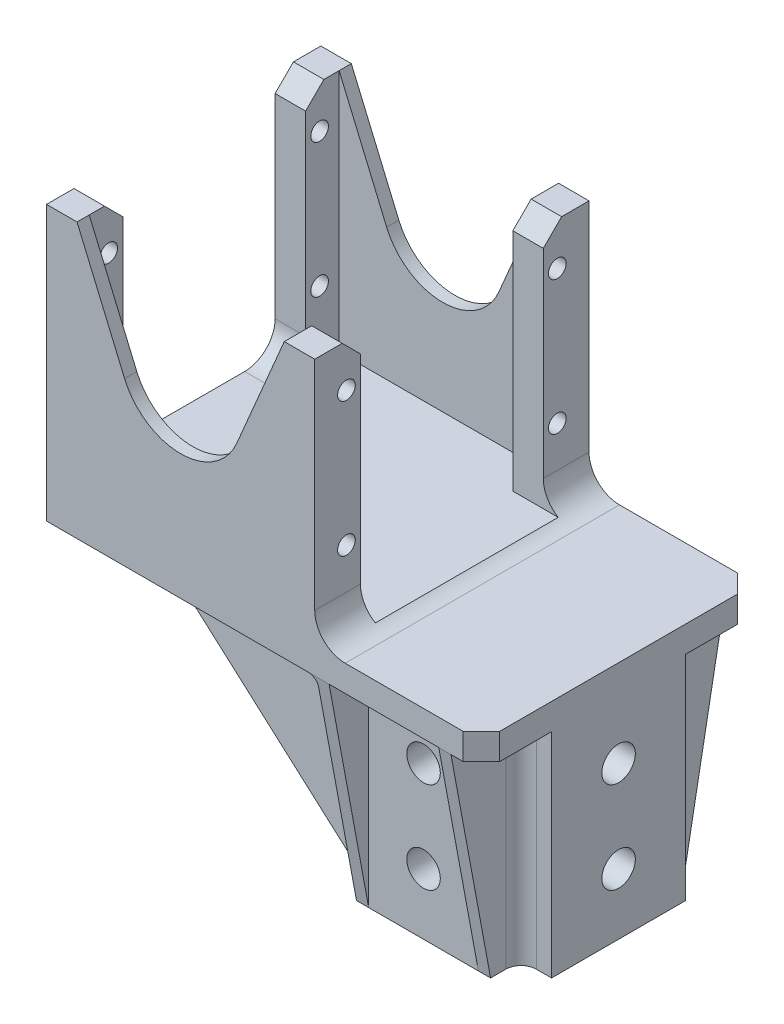
from build123d import *

# Parameters (mm, degrees)
BOSS_EXTRUDE1_DEPTH           = 45
SKETCH3_W                     = 30
SKETCH3_H                     = 40
CUT_EXTRUDE1_DEPTH            = 88.304481557
SKETCH4_W                     = 32
SKETCH4_H                     = 32
SKETCH4_W_2                   = 20.5
SKETCH4_H_2                   = 20.5
BOSS_EXTRUDE2_DEPTH           = 35
SKETCH6_W                     = 5
SKETCH6_H                     = 5
CUT_EXTRUDE4_DEPTH            = 35
RIB1_REACH                    = 87.394
SKETCH9_WALL_W                = 225.450736488
SKETCH9_WALL_H                = 2
LPATTERN1_COUNT               = 2
LPATTERN1_PITCH               = 20
RIB6_REACH                    = 100.659
SKETCH14_WALL_W               = 234.916193708
SKETCH14_WALL_H               = 2
RIB7_START                    = -2
RIB7_DEPTH                    = 2
FILLET2_R                     = 5
FILLET3_R                     = 5
RIB10_REACH                   = 92.525
SKETCH17_WALL_W               = 226.513312862
SKETCH17_WALL_H               = 2
RIB11_REACH                   = 92.525
SKETCH18_WALL_W               = 226.513312862
SKETCH18_WALL_H               = 2
FILLET4_R                     = 10
LPATTERN2_COUNT               = 2
LPATTERN2_PITCH               = 43
FILLET4_OF_LPATTERN2_R        = 10
M5_CLEARANCE_HOLE2_AT_2_COUNT = 2
M5_CLEARANCE_HOLE2_AT_2_PITCH = 15
M2_5_CLEARANCE_HOLE1_D        = 2.9
FILLET5_R                     = 2.5
SKETCH4_4_R                   = 2.5
BOSS_EXTRUDE4_DEPTH           = 8
CIRPATTERN1_COUNT             = 4
CHAMFER1_SIZE                 = 3
FILLET6_R                     = 5
FILLET7_R                     = 1.5
SKETCH27_W                    = 27.35
SKETCH27_H                    = 5.7
CUT_EXTRUDE6_DEPTH            = 91.525342619
FILLET8_R                     = 5


# Read off the part's stored shape, not the designer's step: Rib7
with BuildPart() as part:
    # Sketch2 → Boss-Extrude1 (new body)
    with BuildSketch(Plane.XY):
        Polygon((-53.5125, -22.5), (17.8375, -22.5), (17.8375, -17.5), (-9.5125, -17.5), (-9.5125, 22.5), (-14.5125, 22.5), (-14.5125, -17.5), (-48.5125, -17.5), (-48.5125, 22.5), (-53.5125, 22.5), align=None)
    extrude(amount=BOSS_EXTRUDE1_DEPTH)

    # Sketch3 → Cut-Extrude1 (cut, through all)
    with BuildSketch(Plane(origin=(-53.5125, 0, 0), x_dir=(0, 0, -1), z_dir=(1, 0, 0))):
        with Locations((-22.5, 2.5)):
            Rectangle(SKETCH3_W, SKETCH3_H)
    extrude(amount=CUT_EXTRUDE1_DEPTH, mode=Mode.SUBTRACT)

    # Sketch4 → Boss-Extrude2 (add)
    with BuildSketch(Plane.XZ.offset(22.5)):
        with Locations((1.8375, 22.5)):
            Rectangle(SKETCH4_W, SKETCH4_H)
        with Locations((1.8375, 22.5)):
            Rectangle(SKETCH4_W_2, SKETCH4_H_2, mode=Mode.SUBTRACT)
    extrude(amount=BOSS_EXTRUDE2_DEPTH)

    # Sketch6 → Cut-Extrude4 (cut)
    with BuildSketch(Plane(origin=(0, -57.5, 0), x_dir=(-1, 0, 0), z_dir=(0, -1, 0))):
        with Locations((11.6625, -36)):
            Rectangle(SKETCH6_W, SKETCH6_H)
        with Locations((-15.3375, -36)):
            Rectangle(SKETCH6_W, SKETCH6_H)
        with Locations((-15.3375, -9)):
            Rectangle(SKETCH6_W, SKETCH6_H)
        with Locations((11.6625, -9)):
            Rectangle(SKETCH6_W, SKETCH6_H)
    extrude(amount=-CUT_EXTRUDE4_DEPTH, mode=Mode.SUBTRACT)

    # Sketch9 wall → Rib1 (add, up to next)
    with BuildSketch(Plane(origin=(-33.8375, -40, 33.5), x_dir=(-0.747199752598, 0.664599525818, 0), z_dir=(-0.664599525818, -0.747199752598, 0)), mode=Mode.PRIVATE) as rib1_sk1:
        with Locations((0, 1)):
            Rectangle(SKETCH9_WALL_W, SKETCH9_WALL_H)
    rib1_tool1 = extrude(rib1_sk1.sketch, amount=-RIB1_REACH, mode=Mode.PRIVATE) - part.part
    rib1 = rib1_tool1.solids().sort_by_distance((-33.8375, -40, 33.5))[0]
    add(rib1)

    # LPattern1: Rib1 ×2
    with Locations(*[(0, 0, -i * LPATTERN1_PITCH) for i in range(1, LPATTERN1_COUNT)]):
        add(rib1)

    # Sketch14 wall → Rib6 (add, up to next)
    with BuildSketch(Plane(origin=(12.8375, -40, 3.25), x_dir=(0, 0.983188736076, -0.182592193843), z_dir=(0, 0.182592193843, 0.983188736076)), mode=Mode.PRIVATE) as rib6_sk1:
        with Locations((0, 1)):
            Rectangle(SKETCH14_WALL_W, SKETCH14_WALL_H)
    rib6_tool1 = extrude(rib6_sk1.sketch, amount=RIB6_REACH, mode=Mode.PRIVATE) - part.part
    rib6 = rib6_tool1.solids().sort_by_distance((12.8375, -40, 3.25))[0]
    add(rib6)

    # Rib7 outline → Rib7 (add)
    with BuildSketch(Plane.ZY.offset(9.1625).offset(RIB7_START)):
        Polygon((0, -22.5), (6.5, -57.5), (6.5, -22.5), align=None)
    rib7 = extrude(amount=RIB7_DEPTH)

    # Fillet2
    fillet2_edges = [part.edges().sort_by_distance(p)[0] for p in [
        (1.8375, -22.5, 38.5),
        (-14.1625, -22.5, 22.5),
        (1.8375, -22.5, 6.5),
    ]]
    fillet(fillet2_edges, radius=FILLET2_R)

    # Fillet3
    fillet3_edges = [part.edges().sort_by_distance(p)[0] for p in [
        (-9.5125, -17.5, 41.25),
        (-9.5125, -17.5, 3.75),
    ]]
    fillet(fillet3_edges, radius=FILLET3_R)

    # Sketch17 wall → Rib10 (add, up to next)
    with BuildSketch(Plane(origin=(-40.0125, 2.5, 45), x_dir=(0.391140640345, -0.920330918458, 0), z_dir=(0.920330918458, 0.391140640345, 0)), mode=Mode.PRIVATE) as rib10_sk1:
        with Locations((0, 1)):
            Rectangle(SKETCH17_WALL_W, SKETCH17_WALL_H)
    rib10_tool1 = extrude(rib10_sk1.sketch, amount=-RIB10_REACH, mode=Mode.PRIVATE) - part.part
    rib10 = rib10_tool1.solids().sort_by_distance((-40.0125, 2.5, 45))[0]
    add(rib10)

    # Sketch18 wall → Rib11 (add, up to next)
    with BuildSketch(Plane(origin=(-23.0125, 2.5, 45), x_dir=(0.391140640345, 0.920330918458, 0), z_dir=(-0.920330918458, 0.391140640345, 0)), mode=Mode.PRIVATE) as rib11_sk1:
        with Locations((0, 1)):
            Rectangle(SKETCH18_WALL_W, SKETCH18_WALL_H)
    rib11_tool1 = extrude(rib11_sk1.sketch, amount=-RIB11_REACH, mode=Mode.PRIVATE) - part.part
    rib11 = rib11_tool1.solids().sort_by_distance((-23.0125, 2.5, 45))[0]
    add(rib11)

    # Fillet4
    # the kernel refuses this fillet: 10 mm, written as the material it adds along each edge
    with BuildSketch(Plane(origin=(-31.5125, -17.5, 45), x_dir=(-0.391140640345148, 0.9203309184583486, 0), z_dir=(0, 0, -1))) as fillet4_piece_1:
        with BuildLine():
            CenterArc((FILLET4_R * 2.35294117647, FILLET4_R), FILLET4_R, 136.050984017, 133.949015983)
            Line((FILLET4_R * 1.63298352692, FILLET4_R * 1.69401799894), (0, 0))
            Line((0, 0), (FILLET4_R * 2.35294117647, 0))
        make_face()
    extrude(amount=2)

    # LPattern2: Rib10, Rib11 ×2
    with Locations(*[(0, 0, -i * LPATTERN2_PITCH) for i in range(1, LPATTERN2_COUNT)]):
        add(rib10)
        add(rib11)

    # Fillet4 of LPattern2
    # the kernel refuses this fillet: 10 mm, written as the material it adds along each edge
    with BuildSketch(Plane(origin=(-31.5125, -17.5, 60.823529412), x_dir=(-0.39114064034514817, 0.9203309184583486, 0), z_dir=(0, 0, -1))) as fillet4_of_lpattern2_piece_1_section:
        with BuildLine():
            CenterArc((FILLET4_OF_LPATTERN2_R * 2.35294117647, FILLET4_OF_LPATTERN2_R), FILLET4_OF_LPATTERN2_R, 136.050984017, 133.949015983)
            Line((FILLET4_OF_LPATTERN2_R * 1.63298352692, FILLET4_OF_LPATTERN2_R * 1.69401799894), (0, 0))
            Line((0, 0), (FILLET4_OF_LPATTERN2_R * 2.35294117647, 0))
        make_face()
    fillet4_of_lpattern2_piece_1 = extrude(amount=60.823529412, mode=Mode.PRIVATE)
    fillet4_of_lpattern2_piece_1 = split(fillet4_of_lpattern2_piece_1, bisect_by=Plane(origin=(-31.5125, -6.311496297, 43), z_dir=(0, 0, 1)), keep=Keep.TOP, mode=Mode.PRIVATE)
    fillet4_of_lpattern2_piece_1 = split(fillet4_of_lpattern2_piece_1, bisect_by=Plane(origin=(-31.5125, -6.311496297, 45), z_dir=(0, 0, -1)), keep=Keep.TOP, mode=Mode.PRIVATE)
    add(fillet4_of_lpattern2_piece_1)
    with BuildSketch(Plane(origin=(-31.5125, -17.5, 2), x_dir=(-0.391140640345148, 0.9203309184583486, 0), z_dir=(0, 0, -1))) as fillet4_of_lpattern2_piece_2:
        with BuildLine():
            CenterArc((FILLET4_OF_LPATTERN2_R * 2.35294117647, FILLET4_OF_LPATTERN2_R), FILLET4_OF_LPATTERN2_R, 136.050984017, 133.949015983)
            Line((FILLET4_OF_LPATTERN2_R * 1.63298352692, FILLET4_OF_LPATTERN2_R * 1.69401799894), (0, 0))
            Line((0, 0), (FILLET4_OF_LPATTERN2_R * 2.35294117647, 0))
        make_face()
    extrude(amount=2)

    # Sketch22 → M5 Clearance Hole2 (revolve, cut)
    with BuildSketch(Plane(origin=(1.8375, -32.5, 38.5), x_dir=(0, -1, 0), z_dir=(1, 0, 0))):
        Polygon((0, 0), (0, 7.652366702), (2.75, 6), (2.75, 0), align=None)
    m5_clearance_hole2 = revolve(axis=Axis((1.8375, -32.5, 44.85), (0, 0, -1)), mode=Mode.SUBTRACT)

    # M5 Clearance Hole2 at 2: M5 Clearance Hole2 ×2
    with Locations(*[(0, -i * M5_CLEARANCE_HOLE2_AT_2_PITCH, 0) for i in range(1, M5_CLEARANCE_HOLE2_AT_2_COUNT)]):
        add(m5_clearance_hole2, mode=Mode.SUBTRACT)

    # M2.5 Clearance Hole1 (through all)
    with Locations(Plane.ZY.offset(53.5125)):
        with Locations((5.2, 15.5), (39.8, 15.5), (39.8, -6.5), (5.2, -6.5)):
            Hole(M2_5_CLEARANCE_HOLE1_D / 2)

    # Fillet5
    fillet5_edges = [part.edges().sort_by_distance(p)[0] for p in [
        (-9.1625, -40, 11.5),
        (12.8375, -40, 11.5),
        (12.8375, -40, 33.5),
        (-9.1625, -40, 33.5),
    ]]
    fillet(fillet5_edges, radius=FILLET5_R)

    # Sketch4<4> → Boss-Extrude4 (add)
    with BuildSketch(Plane.XZ.offset(22.5)):
        with Locations(Location((1.8375, 22.5, 0), (0, 0, 180))):
            Circle(SKETCH4_4_R)
    extrude(amount=BOSS_EXTRUDE4_DEPTH)

    # CirPattern1: M5 Clearance Hole2 ×4 about axis
    cirpattern1_axis = Axis((1.8375, -30.5, 22.5), (0, -1, 0))
    for i in range(1, CIRPATTERN1_COUNT):
        add(m5_clearance_hole2.rotate(cirpattern1_axis, i * 360 / CIRPATTERN1_COUNT), mode=Mode.SUBTRACT)

    # CirPattern1 copy 1 sketch → CirPattern1 copy 1 (revolve, cut)
    with BuildSketch(Plane(origin=(-14.1625, -47.5, 22.5), x_dir=(0, -1, 0), z_dir=(0, 0, 1))):
        Polygon((0, 0), (0, 7.652366702), (2.75, 6), (2.75, 0), align=None)
    revolve(axis=Axis((-20.5125, -47.5, 22.5), (1, 0, 0)), mode=Mode.SUBTRACT)

    # CirPattern1 copy 2 sketch → CirPattern1 copy 2 (revolve, cut)
    with BuildSketch(Plane(origin=(1.8375, -47.5, 6.5), x_dir=(0, -1, 0), z_dir=(-1, 0, 0))):
        Polygon((0, 0), (0, 7.652366702), (2.75, 6), (2.75, 0), align=None)
    revolve(axis=Axis((1.8375, -47.5, 0.15), (0, 0, 1)), mode=Mode.SUBTRACT)

    # CirPattern1 copy 3 sketch → CirPattern1 copy 3 (revolve, cut)
    with BuildSketch(Plane(origin=(17.8375, -47.5, 22.5), x_dir=(0, -1, 0), z_dir=(0, 0, -1))):
        Polygon((0, 0), (0, 7.652366702), (2.75, 6), (2.75, 0), align=None)
    revolve(axis=Axis((24.1875, -47.5, 22.5), (-1, 0, 0)), mode=Mode.SUBTRACT)

    # Mirror1: Rib6, Rib7 across plane
    add(rib6.mirror(Plane.XY.offset(22.5)))
    add(rib7.mirror(Plane.XY.offset(22.5)))

    # Chamfer1
    chamfer1_edges = [part.edges().sort_by_distance(p)[0] for p in [
        (17.8375, -20, 0),
        (-12.0125, 22.5, 37.5),
        (-51.0125, 22.5, 37.5),
        (-12.0125, 22.5, 7.5),
        (-51.0125, 22.5, 7.5),
        (17.8375, -20, 45),
    ]]
    chamfer(chamfer1_edges, length=CHAMFER1_SIZE)

    # Fillet6
    fillet6_edges = [part.edges().sort_by_distance(p)[0] for p in [
        (-51.0125, -17.5, 37.5),
        (-51.0125, -17.5, 7.5),
    ]]
    fillet(fillet6_edges, radius=FILLET6_R)

    # Fillet7
    fillet7_edges = [part.edges().sort_by_distance(p)[0] for p in [
        (-9.1625, -22.5, 4.5),
        (-32.5875, -22.5, 33.5),
        (-36.3375, -22.5, 31.5),
        (-36.3375, -22.5, 13.5),
        (-14.1625, -42.5, 13.5),
        (-14.1625, -42.5, 31.5),
        (-15.626966094, -23.964466094, 13.5),
        (-15.626966094, -23.964466094, 31.5),
        (-32.5875, -22.5, 11.5),
        (-9.894733047, -22.5, 10.767766953),
        (-9.1625, -22.5, 40.5),
        (-9.894733047, -22.5, 34.232233047),
    ]]
    fillet(fillet7_edges, radius=FILLET7_R)

    # Sketch27 → Cut-Extrude6 (cut, through all)
    with BuildSketch(Plane.XY.offset(45)):
        with Locations((4.1625, -15.35)):
            Rectangle(SKETCH27_W, SKETCH27_H)
    extrude(amount=-CUT_EXTRUDE6_DEPTH, mode=Mode.SUBTRACT)

    # Fillet8
    # the kernel refuses this fillet: 5 mm, written as the material it adds along each edge
    with BuildSketch(Plane(origin=(-9.5125, -18.2, 45), x_dir=(0, 1, 0), z_dir=(0, 0, -1))) as fillet8_piece_1_section:
        with BuildLine():
            CenterArc((FILLET8_R, FILLET8_R), FILLET8_R, 180, 90)
            Line((0, FILLET8_R), (0, 0))
            Line((0, 0), (FILLET8_R, 0))
        make_face()
    fillet8_piece_1 = extrude(amount=45, mode=Mode.PRIVATE)
    fillet8_piece_1 = split(fillet8_piece_1, bisect_by=Plane(origin=(-8.914614022, -16.345318534, 37.5), z_dir=(0, 0, 1)), keep=Keep.TOP, mode=Mode.PRIVATE)
    fillet8_piece_1 = split(fillet8_piece_1, bisect_by=Plane(origin=(-8.914614022, -17.5, 41.25), z_dir=(0, 1, 0)), keep=Keep.TOP, mode=Mode.PRIVATE)
    add(fillet8_piece_1)
    with BuildSketch(Plane(origin=(-9.5125, -18.2, 45), x_dir=(0, 1, 0), z_dir=(0, 0, -1))) as fillet8_piece_2_section:
        with BuildLine():
            CenterArc((FILLET8_R, FILLET8_R), FILLET8_R, 180, 90)
            Line((0, FILLET8_R), (0, 0))
            Line((0, 0), (FILLET8_R, 0))
        make_face()
    fillet8_piece_2 = extrude(amount=45, mode=Mode.PRIVATE)
    fillet8_piece_2 = split(fillet8_piece_2, bisect_by=Plane(origin=(-7.728908439, -17.94976173, 37.5), z_dir=(0, 0, 1)), keep=Keep.TOP, mode=Mode.PRIVATE)
    fillet8_piece_2 = split(fillet8_piece_2, bisect_by=Plane(origin=(-7.728908439, -17.5, 41.25), z_dir=(0, -1, 0)), keep=Keep.TOP, mode=Mode.PRIVATE)
    add(fillet8_piece_2)
    with BuildSketch(Plane(origin=(-9.5125, -18.2, 45), x_dir=(0, 1, 0), z_dir=(0, 0, -1))) as fillet8_piece_3_section:
        with BuildLine():
            CenterArc((FILLET8_R, FILLET8_R), FILLET8_R, 180, 90)
            Line((0, FILLET8_R), (0, 0))
            Line((0, 0), (FILLET8_R, 0))
        make_face()
    fillet8_piece_3 = extrude(amount=45, mode=Mode.PRIVATE)
    fillet8_piece_3 = split(fillet8_piece_3, bisect_by=Plane(origin=(-7.728908439, -17.94976173, 7.5), z_dir=(0, 0, 1)), keep=Keep.TOP, mode=Mode.PRIVATE)
    fillet8_piece_3 = split(fillet8_piece_3, bisect_by=Plane(origin=(-7.728908439, -17.94976173, 37.5), z_dir=(0, 0, -1)), keep=Keep.TOP, mode=Mode.PRIVATE)
    fillet8_piece_3 = split(fillet8_piece_3, bisect_by=Plane(origin=(-7.728908439, -17.5, 22.5), z_dir=(0, -1, 0)), keep=Keep.TOP, mode=Mode.PRIVATE)
    add(fillet8_piece_3)
    with BuildSketch(Plane(origin=(-9.5125, -18.2, 45), x_dir=(0, 1, 0), z_dir=(0, 0, -1))) as fillet8_piece_4_section:
        with BuildLine():
            CenterArc((FILLET8_R, FILLET8_R), FILLET8_R, 180, 90)
            Line((0, FILLET8_R), (0, 0))
            Line((0, 0), (FILLET8_R, 0))
        make_face()
    fillet8_piece_4 = extrude(amount=45, mode=Mode.PRIVATE)
    fillet8_piece_4 = split(fillet8_piece_4, bisect_by=Plane(origin=(-8.914614022, -16.345318534, 7.5), z_dir=(0, 0, -1)), keep=Keep.TOP, mode=Mode.PRIVATE)
    fillet8_piece_4 = split(fillet8_piece_4, bisect_by=Plane(origin=(-8.914614022, -17.5, 3.75), z_dir=(0, 1, 0)), keep=Keep.TOP, mode=Mode.PRIVATE)
    add(fillet8_piece_4)
    with BuildSketch(Plane(origin=(-9.5125, -18.2, 45), x_dir=(0, 1, 0), z_dir=(0, 0, -1))) as fillet8_piece_5_section:
        with BuildLine():
            CenterArc((FILLET8_R, FILLET8_R), FILLET8_R, 180, 90)
            Line((0, FILLET8_R), (0, 0))
            Line((0, 0), (FILLET8_R, 0))
        make_face()
    fillet8_piece_5 = extrude(amount=45, mode=Mode.PRIVATE)
    fillet8_piece_5 = split(fillet8_piece_5, bisect_by=Plane(origin=(-7.728908439, -17.94976173, 7.5), z_dir=(0, 0, -1)), keep=Keep.TOP, mode=Mode.PRIVATE)
    fillet8_piece_5 = split(fillet8_piece_5, bisect_by=Plane(origin=(-7.728908439, -17.5, 3.75), z_dir=(0, -1, 0)), keep=Keep.TOP, mode=Mode.PRIVATE)
    add(fillet8_piece_5)


solid = part.part
